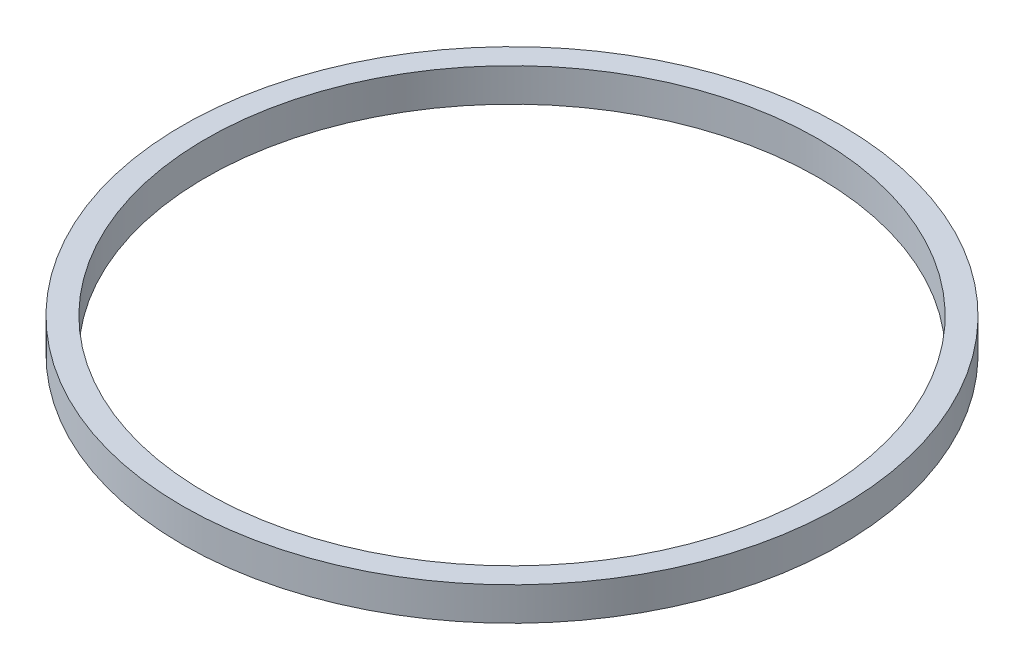
from build123d import *

# Parameters (mm, degrees)
SKETCH1_R           = 42.5
SKETCH1_R_2         = 39.5
BOSS_EXTRUDE1_DEPTH = 4.3


with BuildPart() as part:
    # Sketch1 → Boss-Extrude1 (new body)
    with BuildSketch(Plane(origin=(0, 0, 0), x_dir=(1, 0, 0), z_dir=(0, 1, 0))):
        Circle(SKETCH1_R)
        Circle(SKETCH1_R_2, mode=Mode.SUBTRACT)
    extrude(amount=BOSS_EXTRUDE1_DEPTH)


solid = part.part
